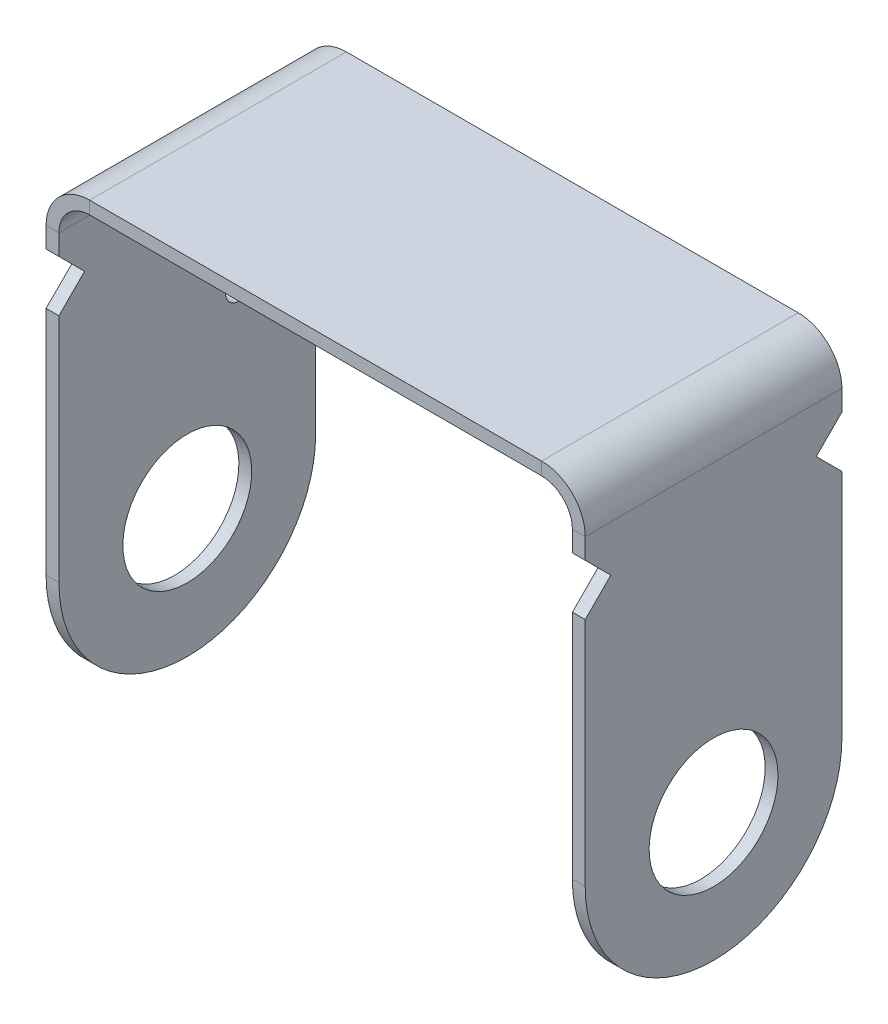
from build123d import *

# Parameters (mm, degrees)
BASE_FLANGE1_DEPTH          = 50
CUT_EXTRUDE1_DEPTH          = 285.297379517
CUT_EXTRUDE1_DEPTH_BACK     = 285.297379517
M12X1_75_TAPPED_HOLE1_D     = 10.2
M12X1_75_TAPPED_HOLE1_DEPTH = 5
BREAK_CORNER2_START         = -105
BREAK_CORNER2_DEPTH         = 210
CUT_EXTRUDE2_DEPTH          = 285.297379517
CUT_EXTRUDE2_DEPTH_BACK     = 285.297379517
SKETCH10_R                  = 25.1


# Read off the part's stored shape, not the designer's step: Break-Corner2
# Sheet-metal steps are written as plain solids
with BuildPart() as part:
    # Sketch1 → Base-Flange1 (new, symmetric)
    with BuildSketch(Plane.XY):
        with BuildLine():
            Line((-105, 0), (-105, 168))
            ThreePointArc((-105, 168), (-100.02081528, 180.02081528), (-88, 185))
            Line((-88, 185), (88, 185))
            ThreePointArc((88, 185), (100.02081528, 180.02081528), (105, 168))
            Line((105, 168), (105, 0))
            Line((105, 0), (100, 0))
            Line((100, 0), (100, 168))
            ThreePointArc((100, 168), (96.485281374, 176.485281374), (88, 180))
            Line((88, 180), (-88, 180))
            ThreePointArc((-88, 180), (-96.485281374, 176.485281374), (-100, 168))
            Line((-100, 168), (-100, 0))
            Line((-100, 0), (-105, 0))
        make_face()
    extrude(amount=BASE_FLANGE1_DEPTH, both=True)

    # Sketch6 → Cut-Extrude1 (cut, two sides: drawn at the far end of the back side and taken through both)
    with BuildSketch(Plane.ZY.offset(105).offset(-CUT_EXTRUDE1_DEPTH_BACK)):
        Polygon((-50, 160), (-40, 150), (-50, 140), align=None)
        Polygon((50, 160), (50, 140), (40, 150), align=None)
    extrude(amount=CUT_EXTRUDE1_DEPTH + CUT_EXTRUDE1_DEPTH_BACK, mode=Mode.SUBTRACT)

    # M12x1.75 Tapped Hole1
    with Locations(Plane.ZY.offset(105)):
        with Locations((-20, 115)):
            Hole(M12X1_75_TAPPED_HOLE1_D / 2, depth=M12X1_75_TAPPED_HOLE1_DEPTH)

    # Break-Corner2 outline → Break-Corner2 (cut)
    with BuildSketch(Plane.YZ.offset(BREAK_CORNER2_START)):
        with BuildLine():
            Line((0, -50), (50, -50))
            ThreePointArc((50, -50), (14.644660941, -35.355339059), (0, 0))
            Line((0, 0), (0, -50))
        make_face()
        with BuildLine():
            Line((0, 50), (0, 0))
            ThreePointArc((0, 0), (14.644660941, 35.355339059), (50, 50))
            Line((50, 50), (0, 50))
        make_face()
    extrude(amount=BREAK_CORNER2_DEPTH, mode=Mode.SUBTRACT)

    # Sketch10 → Cut-Extrude2 (cut, two sides: drawn at the far end of the back side and taken through both)
    with BuildSketch(Plane.ZY.offset(105).offset(-CUT_EXTRUDE2_DEPTH_BACK)):
        with Locations(Location((0, 50, 0), (0, 0, 270))):
            Circle(SKETCH10_R)
    extrude(amount=CUT_EXTRUDE2_DEPTH + CUT_EXTRUDE2_DEPTH_BACK, mode=Mode.SUBTRACT)


solid = part.part
